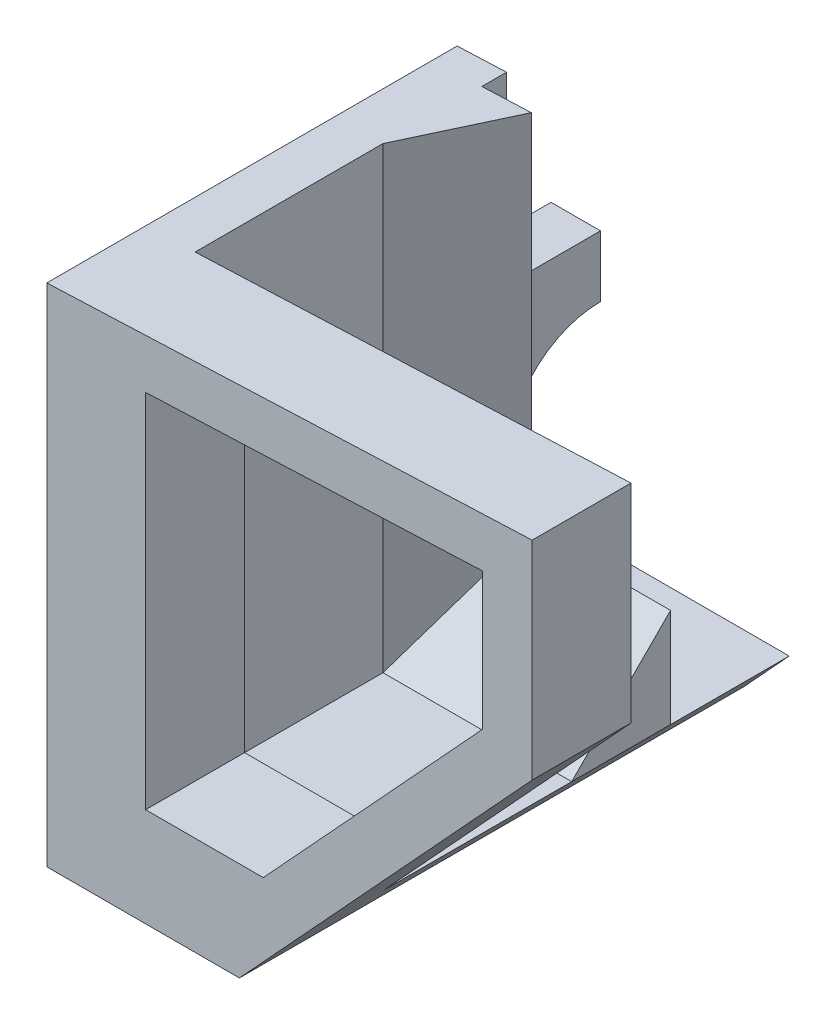
from build123d import *

# Parameters (mm, degrees)
BOSS_EXTRUDE1_DEPTH = 10
BOSS_EXTRUDE6_DEPTH = 41
CUT_EXTRUDE1_REACH  = 81.124
SKETCH6_R           = 9.5
SKETCH6_W           = 9.5
SKETCH6_H           = 18.644559606
CUT_EXTRUDE2_REACH  = 81.124
BOSS_EXTRUDE9_DEPTH = 10
CHAMFER2_SIZE       = 5
CHAMFER2_SIZE_2     = 10
CHAMFER3_SIZE       = 10


# Some blends are built 0.0001 mm under size
with BuildPart() as part:
    # Sketch2 → Boss-Extrude1 (new body)
    with BuildSketch(Plane.XY):
        Polygon((-5, -51.344559606), (-5, -0.20517252), (44.083730464, 1.808954014), (44.083730464, -19.205040291), (14.477900916, -51.344559606), align=None)
    extrude(amount=BOSS_EXTRUDE1_DEPTH)

    # Sketch2<5> → Boss-Extrude6 (add)
    with BuildSketch(Plane.XY):
        Polygon((-5, -0.20517252), (-5, -51.344559606), (14.477900916, -51.344559606), (19.083730464, -46.344559606), (0, -46.344559606), (0, 0), align=None)
    extrude(amount=-BOSS_EXTRUDE6_DEPTH)

    # Sketch6 → Cut-Extrude1 (cut, up to next)
    with BuildSketch(Plane(origin=(0, 0, 0), x_dir=(0, 0, -1), z_dir=(1, 0, 0)), mode=Mode.PRIVATE) as cut_extrude1_sk1:
        with Locations((41, -34.344559606)):
            Circle(SKETCH6_R)
    cut_extrude1_tool1 = extrude(cut_extrude1_sk1.sketch, amount=-CUT_EXTRUDE1_REACH, mode=Mode.PRIVATE) & part.part
    # Sketch6 → Cut-Extrude1 (cut, up to next)
    with BuildSketch(Plane(origin=(0, 0, 0), x_dir=(0, 0, -1), z_dir=(1, 0, 0)), mode=Mode.PRIVATE) as cut_extrude1_sk2:
        with Locations((36.25, -9.322279803)):
            Rectangle(SKETCH6_W, SKETCH6_H)
    cut_extrude1_tool2 = extrude(cut_extrude1_sk2.sketch, amount=-CUT_EXTRUDE1_REACH, mode=Mode.PRIVATE) & part.part
    add(cut_extrude1_tool1.solids().sort_by_distance((0, -34.34456, -41))[0], mode=Mode.SUBTRACT)
    add(cut_extrude1_tool2.solids().sort_by_distance((0, -9.32228, -36.25))[0], mode=Mode.SUBTRACT)

    # Sketch7 → Cut-Extrude2 (cut, up to next)
    with BuildSketch(Plane(origin=(0, 0, 0), x_dir=(-1, 0, 0), z_dir=(0, 0, -1)), mode=Mode.PRIVATE) as cut_extrude2_sk1:
        Polygon((-39.083730464, -17.253097249), (-16.891496625, -41.344559606), (-5, -41.344559606), (-5, -4.799035286), (-39.083730464, -3.400426311), align=None)
    cut_extrude2_tool1 = extrude(cut_extrude2_sk1.sketch, amount=-CUT_EXTRUDE2_REACH, mode=Mode.PRIVATE) & part.part
    add(cut_extrude2_tool1.solids().sort_by_distance((19.604261, -19.893914, 0))[0], mode=Mode.SUBTRACT)

    # Sketch10 → Boss-Extrude9 (add)
    with BuildSketch(Plane.XY.offset(-29)):
        Polygon((19.083730464, -46.344559606), (0, -46.344559606), (0, 0), (5, 0.20517252), (5, -36.344559606), (19.083730464, -36.344559606), align=None)
    extrude(amount=BOSS_EXTRUDE9_DEPTH)

    # Chamfer2
    # the kernel refuses this chamfer: 10, 5 mm, written as the material it takes off along each edge
    with BuildSketch(Plane(origin=(5, 26.103461258, -19), x_dir=(-0.9976223042390326, 0, 0.0689183436017091), z_dir=(0, -1, 0))) as chamfer2_piece_1:
        Polygon((CHAMFER2_SIZE * 0.997622304239, CHAMFER2_SIZE * 0.0689183436017), (-CHAMFER2_SIZE_2 * 0.0689183436017, CHAMFER2_SIZE_2 * 0.997622304239), (0, 0), align=None)
    extrude(amount=62.448020863, mode=Mode.SUBTRACT)

    # Chamfer3
    chamfer3_edges = [part.edges().sort_by_distance(p)[0] for p in [
        (9.541865232, -36.344559606, -19),
    ]]
    chamfer(chamfer3_edges, length=CHAMFER3_SIZE - 0.0001)  # a hair under: the kernel refuses the full size


solid = part.part
